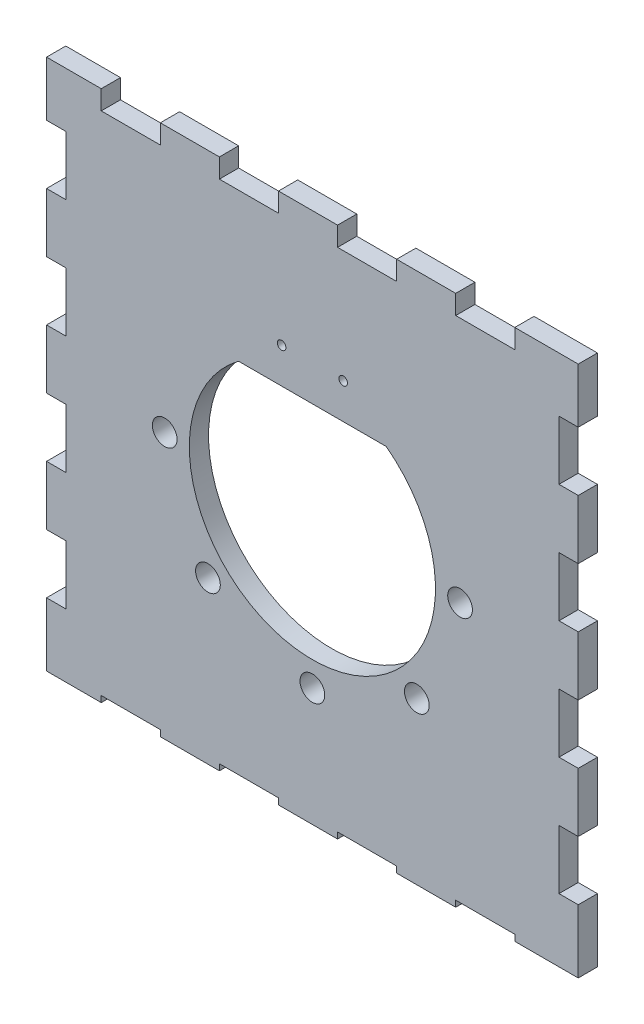
from build123d import *

# Parameters (mm, degrees)
SKETCH1_W           = 137.16
SKETCH1_H           = 137.16
BOSS_EXTRUDE1_DEPTH = 4.9609375
CUT_EXTRUDE1_DEPTH  = 98.11356085
SKETCH4_R           = 3.1877
CUT_EXTRUDE2_DEPTH  = 98.11356085
SKETCH6_W           = 4.9634902
SKETCH6_H           = 15.24
SKETCH6_W_2         = 15.24
SKETCH6_H_2         = 4.9634902
SKETCH6_H_3         = 1.5875
CUT_EXTRUDE5_DEPTH  = 98.11356085
SKETCH7_OUTSIDE_W   = 177.968
SKETCH7_OUTSIDE_H   = 177.968
SKETCH7_OUTSIDE_R   = 1.1049
CUT_EXTRUDE6_DEPTH  = 98.11356085


with BuildPart() as part:
    # Sketch1 → Boss-Extrude1 (new body)
    with BuildSketch(Plane.XY):
        Rectangle(SKETCH1_W, SKETCH1_H)
    extrude(amount=BOSS_EXTRUDE1_DEPTH)

    # Sketch2 → Cut-Extrude1 (cut, through all)
    with BuildSketch(Plane.XY.offset(4.9609375)):
        with BuildLine():
            Line((-19.05, 25.4), (19.05, 25.4))
            ThreePointArc((19.05, 25.4), (0, -31.75), (-19.05, 25.4))
        make_face()
    extrude(amount=-CUT_EXTRUDE1_DEPTH, mode=Mode.SUBTRACT)

    # Sketch4 → Cut-Extrude2 (cut, through all)
    with BuildSketch(Plane.XY.offset(4.9609375)):
        with Locations((-38.1, 0)):
            Circle(SKETCH4_R)
        with Locations((-26.940768363, -26.940768363)):
            Circle(SKETCH4_R)
        with Locations((0, -38.1)):
            Circle(SKETCH4_R)
        with Locations((26.940768363, -26.940768363)):
            Circle(SKETCH4_R)
        with Locations((38.1, 0)):
            Circle(SKETCH4_R)
    extrude(amount=-CUT_EXTRUDE2_DEPTH, mode=Mode.SUBTRACT)

    # Sketch6 → Cut-Extrude5 (cut, through all)
    with BuildSketch(Plane.XY.offset(4.9609375)):
        with Locations((-66.0982549, 16.36776)):
            Rectangle(SKETCH6_W, SKETCH6_H)
        with Locations((-66.0982549, 46.84776)):
            Rectangle(SKETCH6_W, SKETCH6_H)
        with Locations((-66.0982549, -14.11224)):
            Rectangle(SKETCH6_W, SKETCH6_H)
        with Locations((-66.0982549, -44.59224)):
            Rectangle(SKETCH6_W, SKETCH6_H)
        with Locations((66.0982549, 16.36776)):
            Rectangle(SKETCH6_W, SKETCH6_H)
        with Locations((66.0982549, 46.84776)):
            Rectangle(SKETCH6_W, SKETCH6_H)
        with Locations((66.0982549, -14.11224)):
            Rectangle(SKETCH6_W, SKETCH6_H)
        with Locations((66.0982549, -44.59224)):
            Rectangle(SKETCH6_W, SKETCH6_H)
        with Locations((-16.36776, 66.0982549)):
            Rectangle(SKETCH6_W_2, SKETCH6_H_2)
        with Locations((-46.84776, 66.0982549)):
            Rectangle(SKETCH6_W_2, SKETCH6_H_2)
        with Locations((14.11224, 66.0982549)):
            Rectangle(SKETCH6_W_2, SKETCH6_H_2)
        with Locations((44.59224, 66.0982549)):
            Rectangle(SKETCH6_W_2, SKETCH6_H_2)
        with Locations((-16.36776, -67.78625)):
            Rectangle(SKETCH6_W_2, SKETCH6_H_3)
        with Locations((-46.84776, -67.78625)):
            Rectangle(SKETCH6_W_2, SKETCH6_H_3)
        with Locations((14.11224, -67.78625)):
            Rectangle(SKETCH6_W_2, SKETCH6_H_3)
        with Locations((44.59224, -67.78625)):
            Rectangle(SKETCH6_W_2, SKETCH6_H_3)
    extrude(amount=-CUT_EXTRUDE5_DEPTH, mode=Mode.SUBTRACT)

    # Sketch7 outside → Cut-Extrude6 (cut, through all)
    # profile 1 of 3: a face of its own
    with BuildSketch(Plane.XY.offset(4.9609375)):
        Rectangle(SKETCH7_OUTSIDE_W, SKETCH7_OUTSIDE_H)
        Polygon((-63.6165098, 54.46776), (-63.6165098, 39.22776), (-68.58, 39.22776), (-68.58, 23.98776), (-63.6165098, 23.98776), (-63.6165098, 8.74776), (-68.58, 8.74776), (-68.58, -6.49224), (-63.6165098, -6.49224), (-63.6165098, -21.73224), (-68.58, -21.73224), (-68.58, -36.97224), (-63.6165098, -36.97224), (-63.6165098, -52.21224), (-68.58, -52.21224), (-68.58, -68.58), (-54.46776, -68.58), (-54.46776, -66.9925), (-39.22776, -66.9925), (-39.22776, -68.58), (-23.98776, -68.58), (-23.98776, -66.9925), (-8.74776, -66.9925), (-8.74776, -68.58), (6.49224, -68.58), (6.49224, -66.9925), (21.73224, -66.9925), (21.73224, -68.58), (36.97224, -68.58), (36.97224, -66.9925), (52.21224, -66.9925), (52.21224, -68.58), (68.58, -68.58), (68.58, -52.21224), (63.6165098, -52.21224), (63.6165098, -36.97224), (68.58, -36.97224), (68.58, -21.73224), (63.6165098, -21.73224), (63.6165098, -6.49224), (68.58, -6.49224), (68.58, 8.74776), (63.6165098, 8.74776), (63.6165098, 23.98776), (68.58, 23.98776), (68.58, 39.22776), (63.6165098, 39.22776), (63.6165098, 54.46776), (68.58, 54.46776), (68.58, 68.58), (52.21224, 68.58), (52.21224, 63.6165098), (36.97224, 63.6165098), (36.97224, 68.58), (21.73224, 68.58), (21.73224, 63.6165098), (6.49224, 63.6165098), (6.49224, 68.58), (-8.74776, 68.58), (-8.74776, 63.6165098), (-23.98776, 63.6165098), (-23.98776, 68.58), (-39.22776, 68.58), (-39.22776, 63.6165098), (-54.46776, 63.6165098), (-54.46776, 68.58), (-68.58, 68.58), (-68.58, 54.46776), align=None, mode=Mode.SUBTRACT)
    # profile 2 of 3: a face of its own
    with BuildSketch(Plane.XY.offset(4.9609375)):
        with Locations((-7.9375, 34.52749)):
            Circle(SKETCH7_OUTSIDE_R)
    # profile 3 of 3: a face of its own
    with BuildSketch(Plane.XY.offset(4.9609375)):
        with Locations((7.9375, 34.52749)):
            Circle(SKETCH7_OUTSIDE_R)
    extrude(amount=-CUT_EXTRUDE6_DEPTH, mode=Mode.SUBTRACT)


solid = part.part
